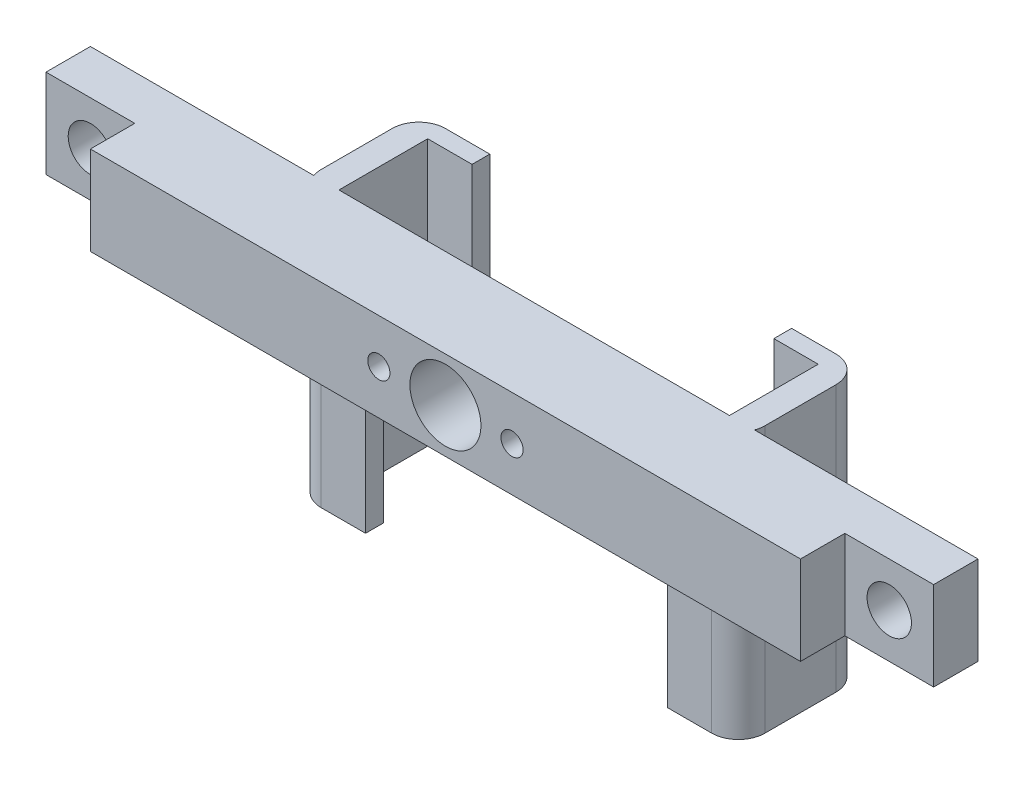
from build123d import *

# Parameters (mm, degrees)
SKETCH1_W           = 100
SKETCH1_H           = 10
BOSS_EXTRUDE1_DEPTH = 10
SKETCH6_W           = 3
SKETCH6_H           = 10
BOSS_EXTRUDE2_DEPTH = 12
SKETCH8_W           = 2
SKETCH8_H           = 10
BOSS_EXTRUDE3_DEPTH = 5
BOSS_EXTRUDE4_DEPTH = 20
SKETCH2_W           = 10
SKETCH2_H           = 5
CUT_EXTRUDE1_DEPTH  = 10
CUT_EXTRUDE2_REACH  = 60.429
SKETCH10_R          = 2.5
CUT_EXTRUDE3_REACH  = 59.175
SKETCH13_R          = 4
SKETCH13_R_2        = 1.25
FILLET1_R           = 3
FILLET2_R           = 3


with BuildPart() as part:
    # Sketch1 → Boss-Extrude1 (new body)
    with BuildSketch(Plane.XY):
        Rectangle(SKETCH1_W, SKETCH1_H)
    extrude(amount=BOSS_EXTRUDE1_DEPTH)

    # Sketch6 → Boss-Extrude2 (add)
    with BuildSketch(Plane(origin=(0, 0, 0), x_dir=(-1, 0, 0), z_dir=(0, 0, -1))):
        with Locations((-23.5, 0)):
            Rectangle(SKETCH6_W, SKETCH6_H)
    boss_extrude2 = extrude(amount=BOSS_EXTRUDE2_DEPTH)

    # Sketch8 → Boss-Extrude3 (add)
    with BuildSketch(Plane.ZY.offset(-22)):
        with Locations((-11, 0)):
            Rectangle(SKETCH8_W, SKETCH8_H)
    boss_extrude3 = extrude(amount=BOSS_EXTRUDE3_DEPTH)

    # Sketch9 → Boss-Extrude4 (add)
    with BuildSketch(Plane.XZ.offset(5)):
        Polygon((17, 2), (17, 0), (22, 0), (22, -10), (17, -10), (17, -12), (25, -12), (25, 0), (25, 2), align=None)
    boss_extrude4 = extrude(amount=BOSS_EXTRUDE4_DEPTH)

    # Mirror3: Boss-Extrude2, Boss-Extrude3, Boss-Extrude4 across plane
    add(boss_extrude2.mirror(Plane(origin=(0, 0, 0), x_dir=(0, 0, 1), z_dir=(1, 0, 0))))
    add(boss_extrude3.mirror(Plane(origin=(0, 0, 0), x_dir=(0, 0, 1), z_dir=(1, 0, 0))))
    add(boss_extrude4.mirror(Plane(origin=(0, 0, 0), x_dir=(0, 0, 1), z_dir=(1, 0, 0))))

    # Sketch2 → Cut-Extrude1 (cut)
    with BuildSketch(Plane(origin=(0, 5, 0), x_dir=(1, 0, 0), z_dir=(0, 1, 0))):
        with Locations((-45, -7.5)):
            Rectangle(SKETCH2_W, SKETCH2_H)
    cut_extrude1 = extrude(amount=-CUT_EXTRUDE1_DEPTH, mode=Mode.SUBTRACT)

    # Mirror4: Cut-Extrude1 across plane
    add(cut_extrude1.mirror(Plane(origin=(0, 0, 0), x_dir=(0, 0, 1), z_dir=(1, 0, 0))), mode=Mode.SUBTRACT)

    # Sketch10 → Cut-Extrude2 (cut, up to next)
    with BuildSketch(Plane.XY.offset(5), mode=Mode.PRIVATE) as cut_extrude2_sk1:
        with Locations((45, 0)):
            Circle(SKETCH10_R)
    cut_extrude2_tool1 = extrude(cut_extrude2_sk1.sketch, amount=-CUT_EXTRUDE2_REACH, mode=Mode.PRIVATE) & part.part
    cut_extrude2 = cut_extrude2_tool1.solids().sort_by_distance((45, 0, 5))[0]
    add(cut_extrude2, mode=Mode.SUBTRACT)

    # Mirror5: Cut-Extrude2 across plane
    add(cut_extrude2.mirror(Plane(origin=(0, 0, 0), x_dir=(0, 0, 1), z_dir=(1, 0, 0))), mode=Mode.SUBTRACT)

    # Sketch13 → Cut-Extrude3 (cut, up to next)
    with BuildSketch(Plane(origin=(0, 0, 0), x_dir=(-1, 0, 0), z_dir=(0, 0, -1)), mode=Mode.PRIVATE) as cut_extrude3_sk1:
        Circle(SKETCH13_R)
    cut_extrude3_tool1 = extrude(cut_extrude3_sk1.sketch, amount=-CUT_EXTRUDE3_REACH, mode=Mode.PRIVATE) & part.part
    # Sketch13 → Cut-Extrude3 (cut, up to next)
    with BuildSketch(Plane(origin=(0, 0, 0), x_dir=(-1, 0, 0), z_dir=(0, 0, -1)), mode=Mode.PRIVATE) as cut_extrude3_sk2:
        with Locations((-7.5, 0)):
            Circle(SKETCH13_R_2)
    cut_extrude3_tool2 = extrude(cut_extrude3_sk2.sketch, amount=-CUT_EXTRUDE3_REACH, mode=Mode.PRIVATE) & part.part
    # Sketch13 → Cut-Extrude3 (cut, up to next)
    with BuildSketch(Plane(origin=(0, 0, 0), x_dir=(-1, 0, 0), z_dir=(0, 0, -1)), mode=Mode.PRIVATE) as cut_extrude3_sk3:
        with Locations((7.5, 0)):
            Circle(SKETCH13_R_2)
    cut_extrude3_tool3 = extrude(cut_extrude3_sk3.sketch, amount=-CUT_EXTRUDE3_REACH, mode=Mode.PRIVATE) & part.part
    add(cut_extrude3_tool1.solids().sort_by_distance((0, 0, 0))[0], mode=Mode.SUBTRACT)
    add(cut_extrude3_tool2.solids().sort_by_distance((7.5, 0, 0))[0], mode=Mode.SUBTRACT)
    add(cut_extrude3_tool3.solids().sort_by_distance((-7.5, 0, 0))[0], mode=Mode.SUBTRACT)

    # Fillet1
    fillet1_edges = [part.edges().sort_by_distance(p)[0] for p in [
        (25, -10, -12),
        (-25, -10, -12),
    ]]
    fillet(fillet1_edges, radius=FILLET1_R)

    # Fillet2
    fillet2_edges = [part.edges().sort_by_distance(p)[0] for p in [
        (-25, -15, 2),
        (25, -15, 2),
    ]]
    fillet(fillet2_edges, radius=FILLET2_R)


solid = part.part
